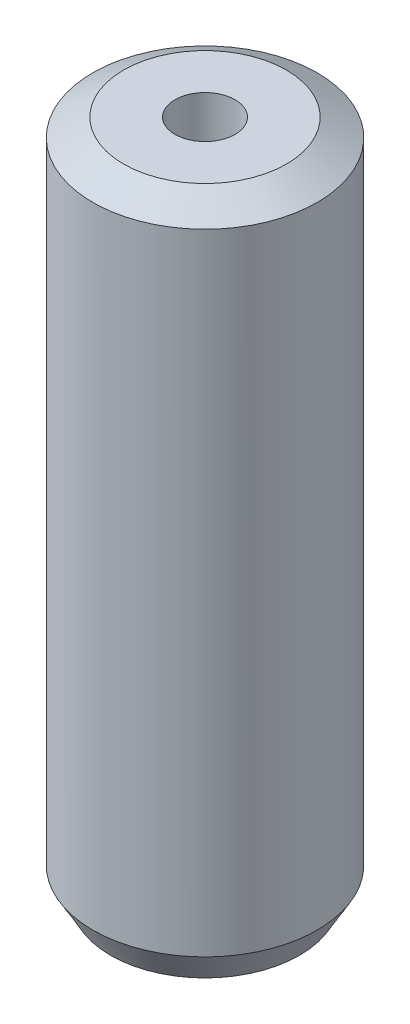
from build123d import *
from OCP.BRepFilletAPI import BRepFilletAPI_MakeChamfer

# Parameters (mm, degrees)
SKETCH1_R           = 5
BOSS_EXTRUDE1_DEPTH = 30.230809196
SKETCH2_R           = 1.338606553
CUT_EXTRUDE1_DEPTH  = 32.046768345
CHAMFER1_SIZE       = 0.79234766
CHAMFER1_SIZE2      = 1.372386405


with BuildPart() as part:
    # Sketch1 → Boss-Extrude1 (new body)
    with BuildSketch(Plane(origin=(0, 0, 0), x_dir=(1, 0, 0), z_dir=(0, 1, 0))):
        Circle(SKETCH1_R)
    extrude(amount=BOSS_EXTRUDE1_DEPTH)

    # Sketch2 → Cut-Extrude1 (cut, through all)
    with BuildSketch(Plane(origin=(0, 0, 0), x_dir=(1, 0, 0), z_dir=(0, 1, 0))):
        Circle(SKETCH2_R)
    extrude(amount=CUT_EXTRUDE1_DEPTH, mode=Mode.SUBTRACT)

    # Chamfer1: one chamfer whose edges measure the first distance from different faces: ONE call of the kernel's chamfer builder (chamfer() names one face for all edges)
    chamfer1_edges_1 = [part.edges().sort_by_distance(p)[0] for p in [
        (-5, 30.230809196, 0),
    ]]
    chamfer1_side_1 = [part.faces().sort_by_distance(p)[0] for p in [
        (-5, 15.115404598, 0),
    ]]
    chamfer1_edges_2 = [part.edges().sort_by_distance(p)[0] for p in [
        (-5, 0, 0),
    ]]
    chamfer1_side_2 = [part.faces().sort_by_distance(p)[0] for p in [
        (-4.858578644, 0, 0),
    ]]
    chamfer1 = BRepFilletAPI_MakeChamfer(part.part.solid().wrapped)
    for e in chamfer1_edges_1:
        chamfer1.Add(CHAMFER1_SIZE, CHAMFER1_SIZE2, e.wrapped, chamfer1_side_1[0].wrapped)  # the first distance lies on this face
    for e in chamfer1_edges_2:
        chamfer1.Add(CHAMFER1_SIZE, CHAMFER1_SIZE2, e.wrapped, chamfer1_side_2[0].wrapped)  # the first distance lies on this face
    add(Compound.cast(chamfer1.Shape()), mode=Mode.REPLACE)


solid = part.part
